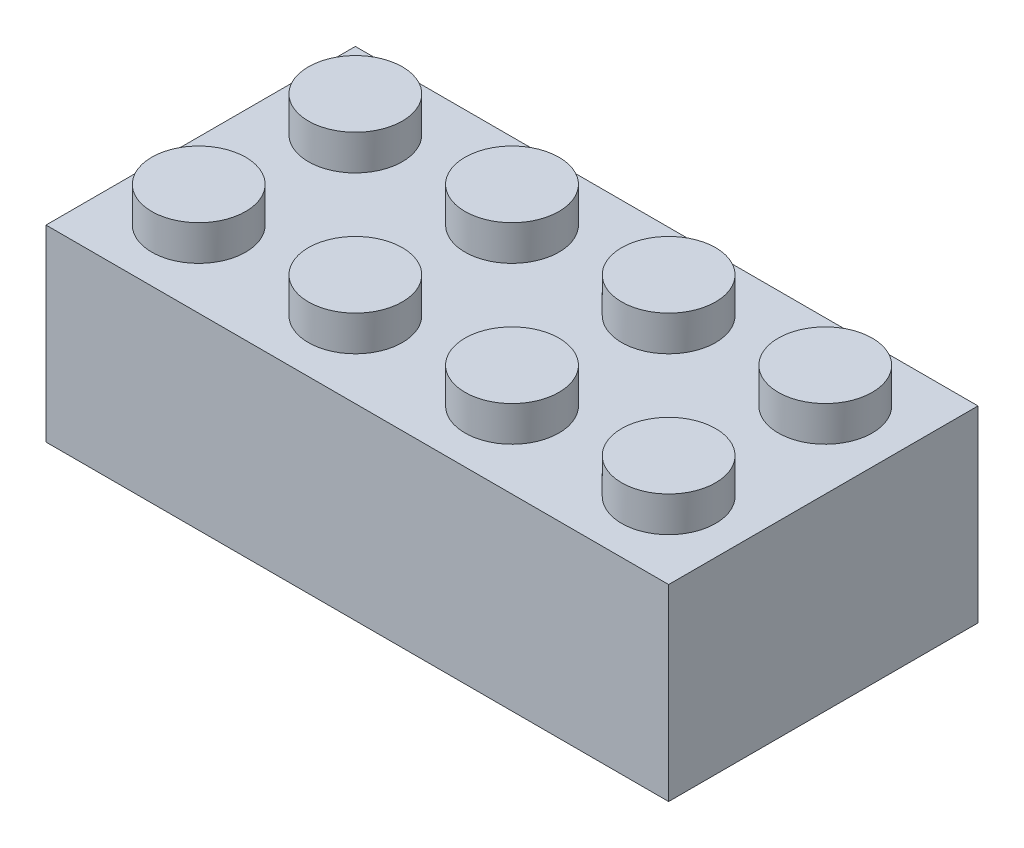
from build123d import *

# Parameters (mm, degrees)
SKETCH1_W           = 31.8
SKETCH1_H           = 15.8
BOSS_EXTRUDE1_DEPTH = 9.6
SHELL1_T            = -1.2
SKETCH2_R           = 2.4
BOSS_EXTRUDE2_DEPTH = 1.8
SKETCH3_R           = 1.4
CUT_EXTRUDE1_DEPTH  = 1.7
BOSS_EXTRUDE3_DEPTH = 6.3


with BuildPart() as part:
    # Sketch1 → Boss-Extrude1 (new body)
    with BuildSketch(Plane(origin=(0, 0, 0), x_dir=(1, 0, 0), z_dir=(0, 1, 0))):
        with Locations((15.9, 7.9)):
            Rectangle(SKETCH1_W, SKETCH1_H)
    extrude(amount=BOSS_EXTRUDE1_DEPTH)

    # Shell1
    shell1_openings = [part.faces().sort_by_distance(p)[0] for p in [
        (15.9, 0, -7.9),
    ]]
    offset(amount=SHELL1_T, openings=shell1_openings, kind=Kind.INTERSECTION)

    # Sketch2 → Boss-Extrude2 (add)
    with BuildSketch(Plane(origin=(0, 9.6, 0), x_dir=(1, 0, 0), z_dir=(0, 1, 0))):
        with Locations((27.9, 11.9)):
            Circle(SKETCH2_R)
        with Locations((19.9, 11.9)):
            Circle(SKETCH2_R)
        with Locations((11.9, 11.9)):
            Circle(SKETCH2_R)
        with Locations((3.9, 11.9)):
            Circle(SKETCH2_R)
        with Locations((19.9, 3.9)):
            Circle(SKETCH2_R)
        with Locations((11.9, 3.9)):
            Circle(SKETCH2_R)
        with Locations((3.9, 3.9)):
            Circle(SKETCH2_R)
        with Locations((27.9, 3.9)):
            Circle(SKETCH2_R)
    extrude(amount=BOSS_EXTRUDE2_DEPTH)

    # Sketch3 → Cut-Extrude1 (cut)
    with BuildSketch(Plane(origin=(0, 8.4, 0), x_dir=(-1, 0, 0), z_dir=(0, -1, 0))):
        with Locations((-3.9, 3.9)):
            Circle(SKETCH3_R)
        with Locations((-11.9, 3.9)):
            Circle(SKETCH3_R)
        with Locations((-19.9, 3.9)):
            Circle(SKETCH3_R)
        with Locations((-27.9, 3.9)):
            Circle(SKETCH3_R)
        with Locations((-11.9, 11.9)):
            Circle(SKETCH3_R)
        with Locations((-19.9, 11.9)):
            Circle(SKETCH3_R)
        with Locations((-27.9, 11.9)):
            Circle(SKETCH3_R)
        with Locations((-3.9, 11.9)):
            Circle(SKETCH3_R)
    extrude(amount=-CUT_EXTRUDE1_DEPTH, mode=Mode.SUBTRACT)

    # Sketch5 → Boss-Extrude3 (add)
    with BuildSketch(Plane.XZ.offset(-8.4)):
        Polygon((15.5, -14.6), (16.3, -14.6), (16.3, -8.18389477), (16.3, -1.2), (15.5, -1.2), align=None)
    extrude(amount=BOSS_EXTRUDE3_DEPTH)


solid = part.part
